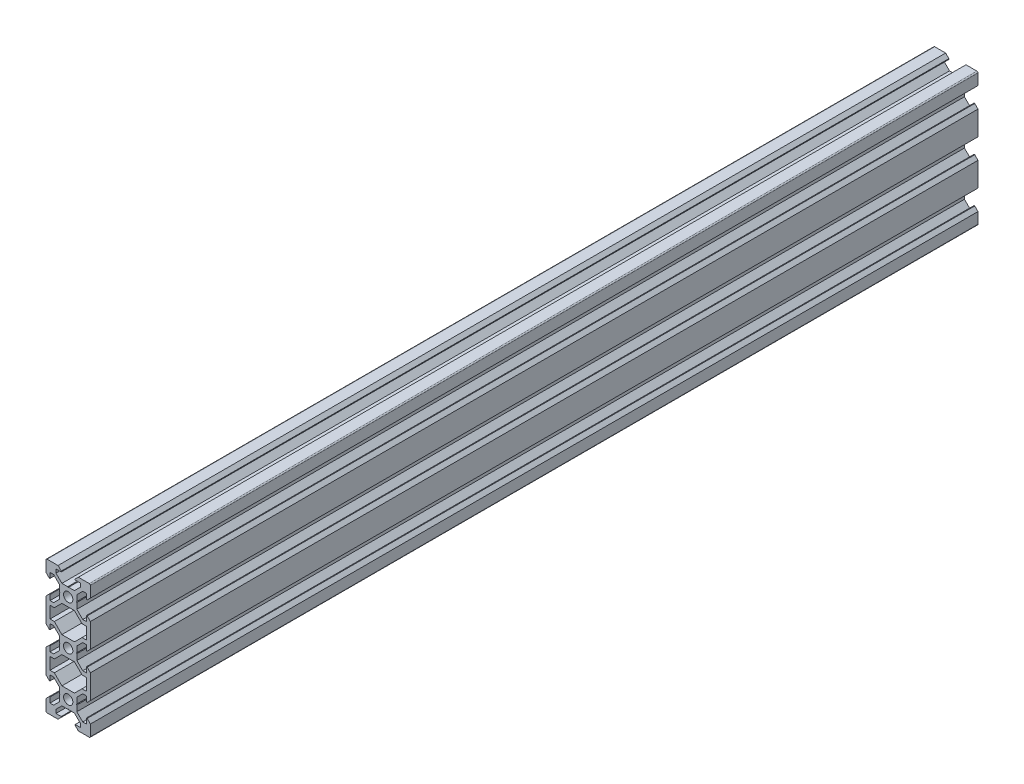
from build123d import *

# Parameters (mm, degrees)
SKETCH1_R           = 2.1
BOSS_EXTRUDE1_DEPTH = 400


with BuildPart() as part:
    # Sketch1 → Boss-Extrude1 (new body)
    with BuildSketch(Plane.XY):
        with BuildLine():
            Line((4.58, -30), (9.5, -30))
            ThreePointArc((9.5, -30), (9.853553391, -29.853553391), (10, -29.5))
            Line((10, -29.5), (10, -24.58))
            Line((10, -24.58), (8.545, -23.125))
            Line((8.545, -23.125), (8.2, -23.125))
            Line((8.2, -23.125), (8.2, -25.5))
            Line((8.2, -25.5), (6.560660172, -25.5))
            Line((6.560660172, -25.5), (3.9, -22.839339828))
            Line((3.9, -22.839339828), (3.9, -20.21))
            Line((3.9, -20.21), (3.69, -20))
            Line((3.69, -20), (3.9, -19.79))
            Line((3.9, -19.79), (3.9, -17.160660172))
            Line((3.9, -17.160660172), (6.560660172, -14.5))
            Line((6.560660172, -14.5), (8.2, -14.5))
            Line((8.2, -14.5), (8.2, -16.875))
            Line((8.2, -16.875), (8.545, -16.875))
            Line((8.545, -16.875), (10, -15.42))
            Line((10, -15.42), (10, -4.58))
            Line((10, -4.58), (8.545, -3.125))
            Line((8.545, -3.125), (8.2, -3.125))
            Line((8.2, -3.125), (8.2, -5.5))
            Line((8.2, -5.5), (6.560660172, -5.5))
            Line((6.560660172, -5.5), (3.9, -2.839339828))
            Line((3.9, -2.839339828), (3.9, -0.21))
            Line((3.9, -0.21), (3.69, 0))
            Line((3.69, 0), (3.9, 0.21))
            Line((3.9, 0.21), (3.9, 2.839339828))
            Line((3.9, 2.839339828), (6.560660172, 5.5))
            Line((6.560660172, 5.5), (8.2, 5.5))
            Line((8.2, 5.5), (8.2, 3.125))
            Line((8.2, 3.125), (8.545, 3.125))
            Line((8.545, 3.125), (10, 4.58))
            Line((10, 4.58), (10, 15.42))
            Line((10, 15.42), (8.545, 16.875))
            Line((8.545, 16.875), (8.2, 16.875))
            Line((8.2, 16.875), (8.2, 14.5))
            Line((8.2, 14.5), (6.560660172, 14.5))
            Line((6.560660172, 14.5), (3.9, 17.160660172))
            Line((3.9, 17.160660172), (3.9, 19.79))
            Line((3.9, 19.79), (3.69, 20))
            Line((3.69, 20), (3.9, 20.21))
            Line((3.9, 20.21), (3.9, 22.839339828))
            Line((3.9, 22.839339828), (6.560660172, 25.5))
            Line((6.560660172, 25.5), (8.2, 25.5))
            Line((8.2, 25.5), (8.2, 23.125))
            Line((8.2, 23.125), (8.545, 23.125))
            Line((8.545, 23.125), (10, 24.58))
            Line((10, 24.58), (10, 29.5))
            ThreePointArc((10, 29.5), (9.853553391, 29.853553391), (9.5, 30))
            Line((9.5, 30), (4.58, 30))
            Line((4.58, 30), (3.125, 28.545))
            Line((3.125, 28.545), (3.125, 28.2))
            Line((3.125, 28.2), (5.5, 28.2))
            Line((5.5, 28.2), (5.5, 26.560660172))
            Line((5.5, 26.560660172), (2.839339828, 23.9))
            Line((2.839339828, 23.9), (0.21, 23.9))
            Line((0.21, 23.9), (0, 23.69))
            Line((0, 23.69), (-0.21, 23.9))
            Line((-0.21, 23.9), (-2.839339828, 23.9))
            Line((-2.839339828, 23.9), (-5.5, 26.560660172))
            Line((-5.5, 26.560660172), (-5.5, 28.2))
            Line((-5.5, 28.2), (-3.125, 28.2))
            Line((-3.125, 28.2), (-3.125, 28.545))
            Line((-3.125, 28.545), (-4.58, 30))
            Line((-4.58, 30), (-9.5, 30))
            ThreePointArc((-9.5, 30), (-9.853553391, 29.853553391), (-10, 29.5))
            Line((-10, 29.5), (-10, 24.58))
            Line((-10, 24.58), (-8.545, 23.125))
            Line((-8.545, 23.125), (-8.2, 23.125))
            Line((-8.2, 23.125), (-8.2, 25.5))
            Line((-8.2, 25.5), (-6.560660172, 25.5))
            Line((-6.560660172, 25.5), (-3.9, 22.839339828))
            Line((-3.9, 22.839339828), (-3.9, 20.21))
            Line((-3.9, 20.21), (-3.69, 20))
            Line((-3.69, 20), (-3.9, 19.79))
            Line((-3.9, 19.79), (-3.9, 17.160660172))
            Line((-3.9, 17.160660172), (-6.560660172, 14.5))
            Line((-6.560660172, 14.5), (-8.2, 14.5))
            Line((-8.2, 14.5), (-8.2, 16.875))
            Line((-8.2, 16.875), (-8.545, 16.875))
            Line((-8.545, 16.875), (-10, 15.42))
            Line((-10, 15.42), (-10, 4.58))
            Line((-10, 4.58), (-8.545, 3.125))
            Line((-8.545, 3.125), (-8.2, 3.125))
            Line((-8.2, 3.125), (-8.2, 5.5))
            Line((-8.2, 5.5), (-6.560660172, 5.5))
            Line((-6.560660172, 5.5), (-3.9, 2.839339828))
            Line((-3.9, 2.839339828), (-3.9, 0.21))
            Line((-3.9, 0.21), (-3.69, 0))
            Line((-3.69, 0), (-3.9, -0.21))
            Line((-3.9, -0.21), (-3.9, -2.839339828))
            Line((-3.9, -2.839339828), (-6.560660172, -5.5))
            Line((-6.560660172, -5.5), (-8.2, -5.5))
            Line((-8.2, -5.5), (-8.2, -3.125))
            Line((-8.2, -3.125), (-8.545, -3.125))
            Line((-8.545, -3.125), (-10, -4.58))
            Line((-10, -4.58), (-10, -15.42))
            Line((-10, -15.42), (-8.545, -16.875))
            Line((-8.545, -16.875), (-8.2, -16.875))
            Line((-8.2, -16.875), (-8.2, -14.5))
            Line((-8.2, -14.5), (-6.560660172, -14.5))
            Line((-6.560660172, -14.5), (-3.9, -17.160660172))
            Line((-3.9, -17.160660172), (-3.9, -19.79))
            Line((-3.9, -19.79), (-3.69, -20))
            Line((-3.69, -20), (-3.9, -20.21))
            Line((-3.9, -20.21), (-3.9, -22.839339828))
            Line((-3.9, -22.839339828), (-6.560660172, -25.5))
            Line((-6.560660172, -25.5), (-8.2, -25.5))
            Line((-8.2, -25.5), (-8.2, -23.125))
            Line((-8.2, -23.125), (-8.545, -23.125))
            Line((-8.545, -23.125), (-10, -24.58))
            Line((-10, -24.58), (-10, -29.5))
            ThreePointArc((-10, -29.5), (-9.853553391, -29.853553391), (-9.5, -30))
            Line((-9.5, -30), (-4.58, -30))
            Line((-4.58, -30), (-3.125, -28.545))
            Line((-3.125, -28.545), (-3.125, -28.2))
            Line((-3.125, -28.2), (-5.5, -28.2))
            Line((-5.5, -28.2), (-5.5, -26.560660172))
            Line((-5.5, -26.560660172), (-2.839339828, -23.9))
            Line((-2.839339828, -23.9), (-0.21, -23.9))
            Line((-0.21, -23.9), (0, -23.69))
            Line((0, -23.69), (0.21, -23.9))
            Line((0.21, -23.9), (2.839339828, -23.9))
            Line((2.839339828, -23.9), (5.5, -26.560660172))
            Line((5.5, -26.560660172), (5.5, -28.2))
            Line((5.5, -28.2), (3.125, -28.2))
            Line((3.125, -28.2), (3.125, -28.545))
            Line((3.125, -28.545), (4.58, -30))
        make_face()
        with Locations((0, -20)):
            Circle(SKETCH1_R, mode=Mode.SUBTRACT)
        Polygon((-6.239339828, -12.7), (-8.2, -12.7), (-8.2, -7.3), (-6.239339828, -7.3), (-2.839339828, -3.9), (2.839339828, -3.9), (6.239339828, -7.3), (8.2, -7.3), (8.2, -12.7), (6.239339828, -12.7), (2.839339828, -16.1), (-2.839339828, -16.1), align=None, mode=Mode.SUBTRACT)
        Polygon((-6.239339828, 7.3), (-8.2, 7.3), (-8.2, 12.7), (-6.239339828, 12.7), (-2.839339828, 16.1), (2.839339828, 16.1), (6.239339828, 12.7), (8.2, 12.7), (8.2, 7.3), (6.239339828, 7.3), (2.839339828, 3.9), (-2.839339828, 3.9), align=None, mode=Mode.SUBTRACT)
        with Locations((0, 20)):
            Circle(SKETCH1_R, mode=Mode.SUBTRACT)
        Circle(SKETCH1_R, mode=Mode.SUBTRACT)
    extrude(amount=BOSS_EXTRUDE1_DEPTH)


solid = part.part
